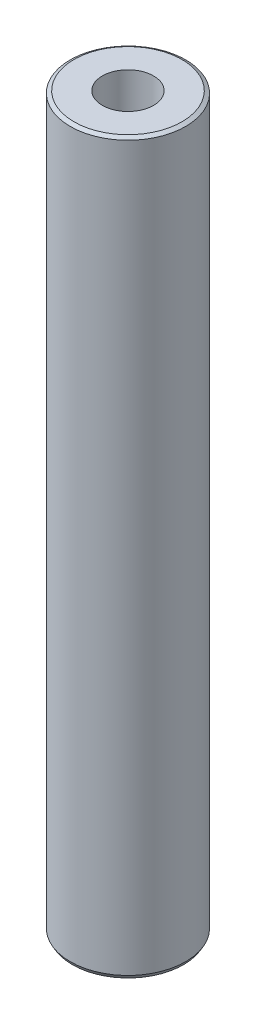
from build123d import *
from OCP.BRepFilletAPI import BRepFilletAPI_MakeChamfer

# Parameters (mm, degrees)
SKETCH1_R           = 47.5
BOSS_EXTRUDE1_DEPTH = 600
SKETCH2_R           = 21.051923311
CUT_EXTRUDE1_DEPTH  = 604.748706003
CHAMFER1_SIZE       = 1.775404507
CHAMFER1_SIZE2      = 3.07509081


with BuildPart() as part:
    # Sketch1 → Boss-Extrude1 (new body)
    with BuildSketch(Plane(origin=(0, 0, 0), x_dir=(1, 0, 0), z_dir=(0, 1, 0))):
        Circle(SKETCH1_R)
    extrude(amount=BOSS_EXTRUDE1_DEPTH)

    # Sketch2 → Cut-Extrude1 (cut, through all)
    with BuildSketch(Plane(origin=(0, 0, 0), x_dir=(1, 0, 0), z_dir=(0, 1, 0))):
        Circle(SKETCH2_R)
    extrude(amount=CUT_EXTRUDE1_DEPTH, mode=Mode.SUBTRACT)

    # Chamfer1: one chamfer whose edges measure the first distance from different faces: ONE call of the kernel's chamfer builder (chamfer() names one face for all edges)
    chamfer1_edges_1 = [part.edges().sort_by_distance(p)[0] for p in [
        (-47.5, 600, 0),
    ]]
    chamfer1_side_1 = [part.faces().sort_by_distance(p)[0] for p in [
        (-47.5, 300, 0),
    ]]
    chamfer1_edges_2 = [part.edges().sort_by_distance(p)[0] for p in [
        (-47.5, 0, 0),
    ]]
    chamfer1_side_2 = [part.faces().sort_by_distance(p)[0] for p in [
        (-46.156497116, 0, 0),
    ]]
    chamfer1 = BRepFilletAPI_MakeChamfer(part.part.solid().wrapped)
    for e in chamfer1_edges_1:
        chamfer1.Add(CHAMFER1_SIZE, CHAMFER1_SIZE2, e.wrapped, chamfer1_side_1[0].wrapped)  # the first distance lies on this face
    for e in chamfer1_edges_2:
        chamfer1.Add(CHAMFER1_SIZE, CHAMFER1_SIZE2, e.wrapped, chamfer1_side_2[0].wrapped)  # the first distance lies on this face
    add(Compound.cast(chamfer1.Shape()), mode=Mode.REPLACE)


solid = part.part
